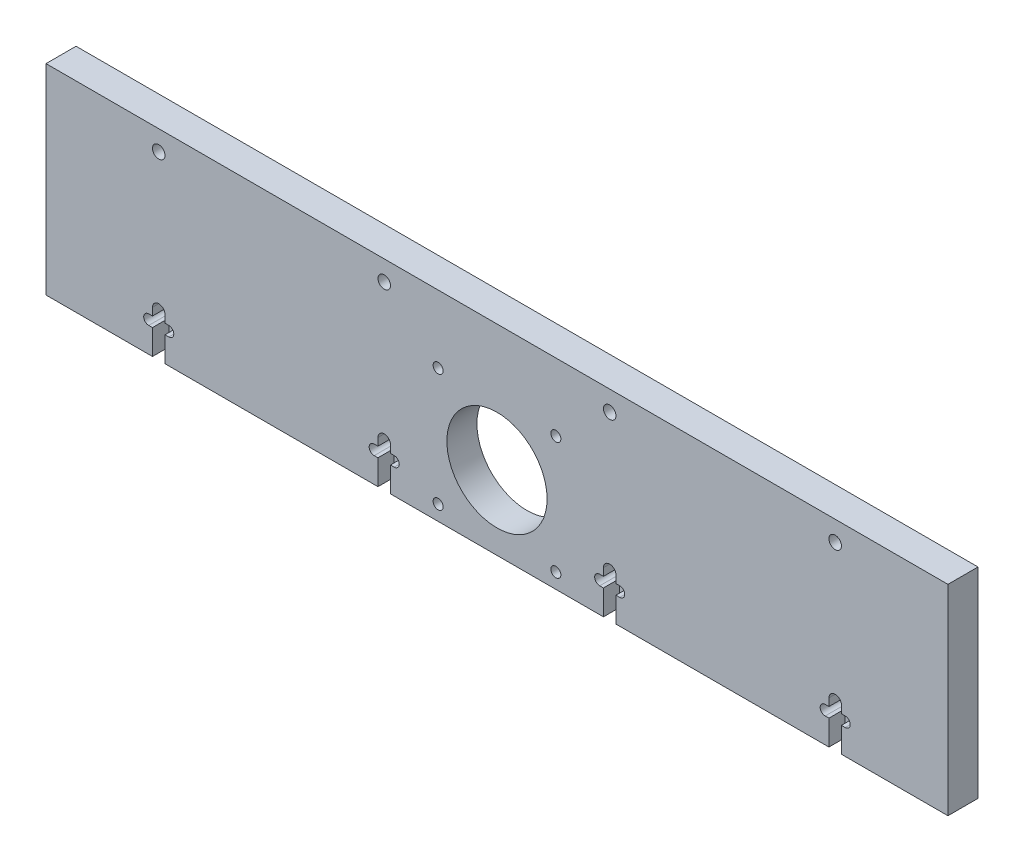
from build123d import *

# Parameters (mm, degrees)
SKETCH1_W           = 360
SKETCH1_H           = 80
BOSS_EXTRUDE1_DEPTH = 12
CUT_EXTRUDE1_REACH  = 186.781
SKETCH2_R           = 2.5
CUT_EXTRUDE4_DEPTH  = 8
CUT_EXTRUDE5_DEPTH  = 6.5
LPATTERN1_COUNT     = 4
LPATTERN1_PITCH     = 90
CUT_EXTRUDE2_REACH  = 186.781
SKETCH3_R           = 20
CUT_EXTRUDE3_REACH  = 186.781
SKETCH4_R           = 2


with BuildPart() as part:
    # Sketch1 → Boss-Extrude1 (new body)
    with BuildSketch(Plane.XY):
        Rectangle(SKETCH1_W, SKETCH1_H)
    extrude(amount=BOSS_EXTRUDE1_DEPTH)

    # Sketch2 → Cut-Extrude1 (cut, up to next)
    with BuildSketch(Plane.XY.offset(12), mode=Mode.PRIVATE) as cut_extrude1_sk1:
        with Locations((135, 32)):
            Circle(SKETCH2_R)
    cut_extrude1_tool1 = extrude(cut_extrude1_sk1.sketch, amount=-CUT_EXTRUDE1_REACH, mode=Mode.PRIVATE) & part.part
    cut_extrude1 = cut_extrude1_tool1.solids().sort_by_distance((135, 32, 12))[0]
    add(cut_extrude1, mode=Mode.SUBTRACT)

    # Sketch6 → Cut-Extrude4 (cut)
    with BuildSketch(Plane(origin=(-192.139840644, 109.556728653, 12), x_dir=(1, 0, 0), z_dir=(0, 0, 1))):
        with BuildLine():
            Line((323.139840644, -135.556728653), (331.139840644, -135.556728653))
            ThreePointArc((331.139840644, -135.556728653), (333.139840644, -137.556728653), (331.139840644, -139.556728653))
            Line((331.139840644, -139.556728653), (323.139840644, -139.556728653))
            ThreePointArc((323.139840644, -139.556728653), (321.139840644, -137.556728653), (323.139840644, -135.556728653))
        make_face()
    cut_extrude4 = extrude(amount=-CUT_EXTRUDE4_DEPTH, mode=Mode.SUBTRACT)

    # Sketch8 → Cut-Extrude5 (cut)
    with BuildSketch(Plane(origin=(-192.139840644, 109.556728653, 12), x_dir=(1, 0, 0), z_dir=(0, 0, 1))):
        with BuildLine():
            Line((329.639840644, -132.556728653), (329.639840644, -186.186588047))
            ThreePointArc((329.639840644, -186.186588047), (327.139840644, -188.686588047), (324.639840644, -186.186588047))
            Line((324.639840644, -186.186588047), (324.639840644, -132.556728653))
            ThreePointArc((324.639840644, -132.556728653), (327.139840644, -130.056728653), (329.639840644, -132.556728653))
        make_face()
    cut_extrude5 = extrude(amount=-CUT_EXTRUDE5_DEPTH, mode=Mode.SUBTRACT)

    # LPattern1: Cut-Extrude1, Cut-Extrude4, Cut-Extrude5 ×4
    with Locations(*[(-i * LPATTERN1_PITCH, 0, 0) for i in range(1, LPATTERN1_COUNT)]):
        add(cut_extrude1, mode=Mode.SUBTRACT)
        add(cut_extrude4, mode=Mode.SUBTRACT)
        add(cut_extrude5, mode=Mode.SUBTRACT)

    # Sketch3 → Cut-Extrude2 (cut, up to next)
    with BuildSketch(Plane.XY.offset(12), mode=Mode.PRIVATE) as cut_extrude2_sk1:
        with Locations((0, -10.5)):
            Circle(SKETCH3_R)
    cut_extrude2_tool1 = extrude(cut_extrude2_sk1.sketch, amount=-CUT_EXTRUDE2_REACH, mode=Mode.PRIVATE) & part.part
    add(cut_extrude2_tool1.solids().sort_by_distance((0, -10.5, 12))[0], mode=Mode.SUBTRACT)

    # Sketch4 → Cut-Extrude3 (cut, up to next)
    with BuildSketch(Plane.XY.offset(12), mode=Mode.PRIVATE) as cut_extrude3_sk1:
        with Locations((-23.5, 13)):
            Circle(SKETCH4_R)
    cut_extrude3_tool1 = extrude(cut_extrude3_sk1.sketch, amount=-CUT_EXTRUDE3_REACH, mode=Mode.PRIVATE) & part.part
    # Sketch4 → Cut-Extrude3 (cut, up to next)
    with BuildSketch(Plane.XY.offset(12), mode=Mode.PRIVATE) as cut_extrude3_sk2:
        with Locations((-23.5, -34)):
            Circle(SKETCH4_R)
    cut_extrude3_tool2 = extrude(cut_extrude3_sk2.sketch, amount=-CUT_EXTRUDE3_REACH, mode=Mode.PRIVATE) & part.part
    cut_extrude3_1 = cut_extrude3_tool1.solids().sort_by_distance((-23.5, 13, 12))[0]
    add(cut_extrude3_1, mode=Mode.SUBTRACT)
    cut_extrude3_2 = cut_extrude3_tool2.solids().sort_by_distance((-23.5, -34, 12))[0]
    add(cut_extrude3_2, mode=Mode.SUBTRACT)
    cut_extrude3 = cut_extrude3_1 + cut_extrude3_2  # Cut-Extrude3 as one shape, for the pattern or mirror that repeats it

    # Mirror2: Cut-Extrude3 across plane
    add(cut_extrude3.mirror(Plane(origin=(0, 0, 0), x_dir=(0, 0, 1), z_dir=(1, 0, 0))), mode=Mode.SUBTRACT)


solid = part.part
